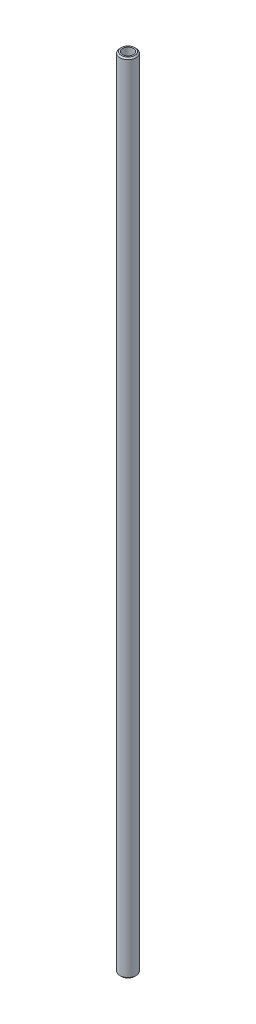
from build123d import *

# Parameters (mm, degrees)
ESQUISSE2_R        = 3
ESQUISSE2_R_2      = 2
BOSS_EXTRU_1_DEPTH = 295
CHANFREIN1_SIZE    = 0.5


with BuildPart() as part:
    # Esquisse2 → Boss.-Extru.1 (new body)
    with BuildSketch(Plane(origin=(0, 0, 0), x_dir=(1, 0, 0), z_dir=(0, 1, 0))):
        with Locations((2763.955255652, -518.296744758)):
            Circle(ESQUISSE2_R)
        with Locations((2763.955255652, -518.296744758)):
            Circle(ESQUISSE2_R_2, mode=Mode.SUBTRACT)
    extrude(amount=BOSS_EXTRU_1_DEPTH)

    # Chanfrein1
    chanfrein1_edges = [part.edges().sort_by_distance(p)[0] for p in [
        (2760.955255652, 295, 518.296744758),
        (2760.955255652, 0, 518.296744758),
    ]]
    chamfer(chanfrein1_edges, length=CHANFREIN1_SIZE)


solid = part.part
